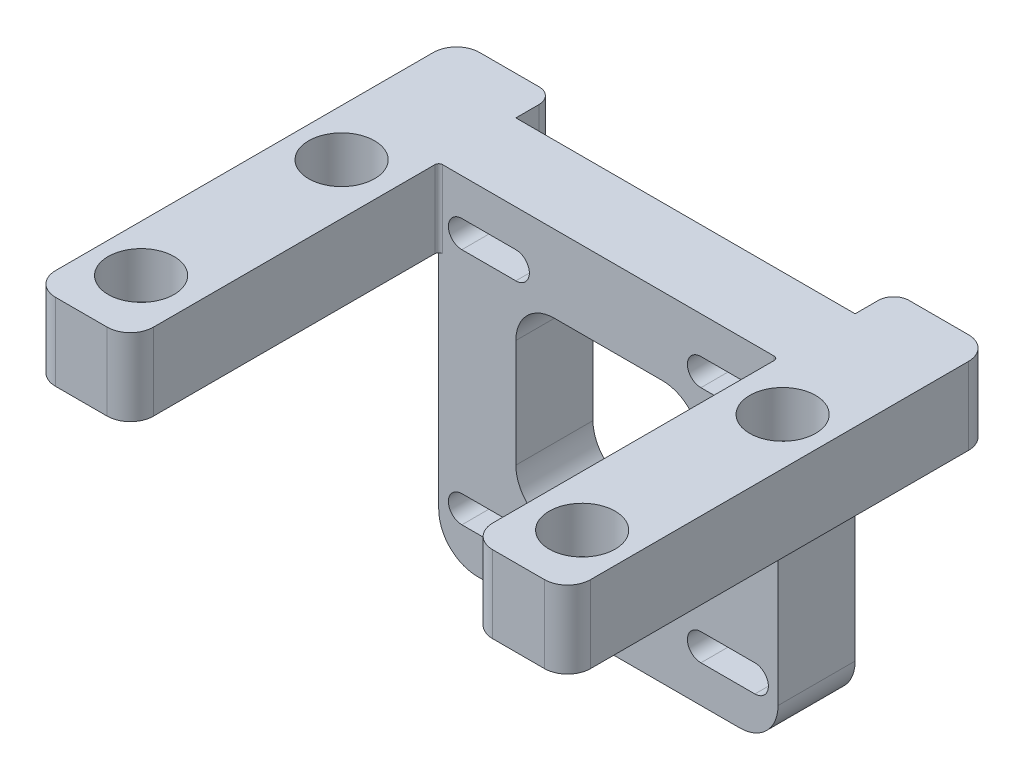
from build123d import *

# Parameters (mm, degrees)
SKETCH1_W           = 44
SKETCH1_H           = 44
BOSS_EXTRUDE1_DEPTH = 10
BOSS_EXTRUDE2_DEPTH = 12.7
SKETCH3_R           = 2.6
CUT_EXTRUDE1_DEPTH  = 70.714345726
SKETCH4_R           = 4.275
CUT_EXTRUDE2_DEPTH  = 72.750191637
FILLET1_R           = 3
FILLET2_R           = 5
FILLET3_R           = 0.5
FILLET4_R           = 2


with BuildPart() as part:
    # Sketch1 → Boss-Extrude1 (new body)
    with BuildSketch(Plane.XY):
        Rectangle(SKETCH1_W, SKETCH1_H)
        with BuildLine():
            Line((7, 12), (-7, 12))
            ThreePointArc((-7, 12), (-10.535533906, 10.535533906), (-12, 7))
            Line((-12, 7), (-12, -7))
            ThreePointArc((-12, -7), (-10.535533906, -10.535533906), (-7, -12))
            Line((-7, -12), (7, -12))
            ThreePointArc((7, -12), (10.535533906, -10.535533906), (12, -7))
            Line((12, -7), (12, 7))
            ThreePointArc((12, 7), (10.535533906, 10.535533906), (7, 12))
        make_face(mode=Mode.SUBTRACT)
        with BuildLine():
            Line((-19, 17.2), (-12, 17.2))
            ThreePointArc((-12, 17.2), (-10.25, 15.45), (-12, 13.7))
            Line((-12, 13.7), (-19, 13.7))
            ThreePointArc((-19, 13.7), (-20.75, 15.45), (-19, 17.2))
        make_face(mode=Mode.SUBTRACT)
        with BuildLine():
            Line((-19, -17.2), (-12, -17.2))
            ThreePointArc((-12, -17.2), (-10.25, -15.45), (-12, -13.7))
            Line((-12, -13.7), (-19, -13.7))
            ThreePointArc((-19, -13.7), (-20.75, -15.45), (-19, -17.2))
        make_face(mode=Mode.SUBTRACT)
        with BuildLine():
            Line((12, 17.2), (19, 17.2))
            ThreePointArc((19, 17.2), (20.75, 15.45), (19, 13.7))
            Line((19, 13.7), (12, 13.7))
            ThreePointArc((12, 13.7), (10.25, 15.45), (12, 17.2))
        make_face(mode=Mode.SUBTRACT)
        with BuildLine():
            Line((12, -13.7), (19, -13.7))
            ThreePointArc((19, -13.7), (20.75, -15.45), (19, -17.2))
            Line((19, -17.2), (12, -17.2))
            ThreePointArc((12, -17.2), (10.25, -15.45), (12, -13.7))
        make_face(mode=Mode.SUBTRACT)
    extrude(amount=BOSS_EXTRUDE1_DEPTH)

    # Sketch2 → Boss-Extrude2 (add)
    with BuildSketch(Plane(origin=(22, 0, 0), x_dir=(0, 0, -1), z_dir=(1, 0, 0))):
        Polygon((5, 12), (-50, 12), (-50, 16), (-50, 22), (5, 22), align=None)
    boss_extrude2 = extrude(amount=BOSS_EXTRUDE2_DEPTH)

    # Sketch3 → Cut-Extrude1 (cut, through all)
    with BuildSketch(Plane.XZ.offset(-12)):
        with Locations((28.6, 42)):
            Circle(SKETCH3_R)
        with Locations((28.6, 16)):
            Circle(SKETCH3_R)
    cut_extrude1 = extrude(amount=-CUT_EXTRUDE1_DEPTH, mode=Mode.SUBTRACT)

    # Sketch4 → Cut-Extrude2 (cut, through all)
    with BuildSketch(Plane(origin=(0, 16, 0), x_dir=(-1, 0, 0), z_dir=(0, -1, 0))):
        with Locations((-28.6, -16)):
            Circle(SKETCH4_R)
        with Locations((-28.6, -42)):
            Circle(SKETCH4_R)
    cut_extrude2 = extrude(amount=-CUT_EXTRUDE2_DEPTH, mode=Mode.SUBTRACT)

    # Mirror1: Boss-Extrude2, Cut-Extrude1, Cut-Extrude2 across plane
    add(boss_extrude2.mirror(Plane(origin=(0, 0, 0), x_dir=(0, 0, 1), z_dir=(1, 0, 0))))
    add(cut_extrude1.mirror(Plane(origin=(0, 0, 0), x_dir=(0, 0, 1), z_dir=(1, 0, 0))), mode=Mode.SUBTRACT)
    add(cut_extrude2.mirror(Plane(origin=(0, 0, 0), x_dir=(0, 0, 1), z_dir=(1, 0, 0))), mode=Mode.SUBTRACT)

    # Fillet1
    fillet1_edges = [part.edges().sort_by_distance(p)[0] for p in [
        (34.7, 17, -5),
        (-34.7, 17, -5),
        (34.7, 17, 50),
        (22, 17, 50),
        (-22, 17, 50),
        (-34.7, 17, 50),
    ]]
    fillet(fillet1_edges, radius=FILLET1_R)

    # Fillet2
    fillet2_edges = [part.edges().sort_by_distance(p)[0] for p in [
        (22, -22, 5),
        (-22, -22, 5),
    ]]
    fillet(fillet2_edges, radius=FILLET2_R)

    # Fillet3
    fillet3_edges = [part.edges().sort_by_distance(p)[0] for p in [
        (-22, 17, 10),
        (22, 17, 10),
    ]]
    fillet(fillet3_edges, radius=FILLET3_R)

    # Fillet4
    fillet4_edges = [part.edges().sort_by_distance(p)[0] for p in [
        (22, 17, -5),
        (-22, 17, -5),
    ]]
    fillet(fillet4_edges, radius=FILLET4_R)


solid = part.part
